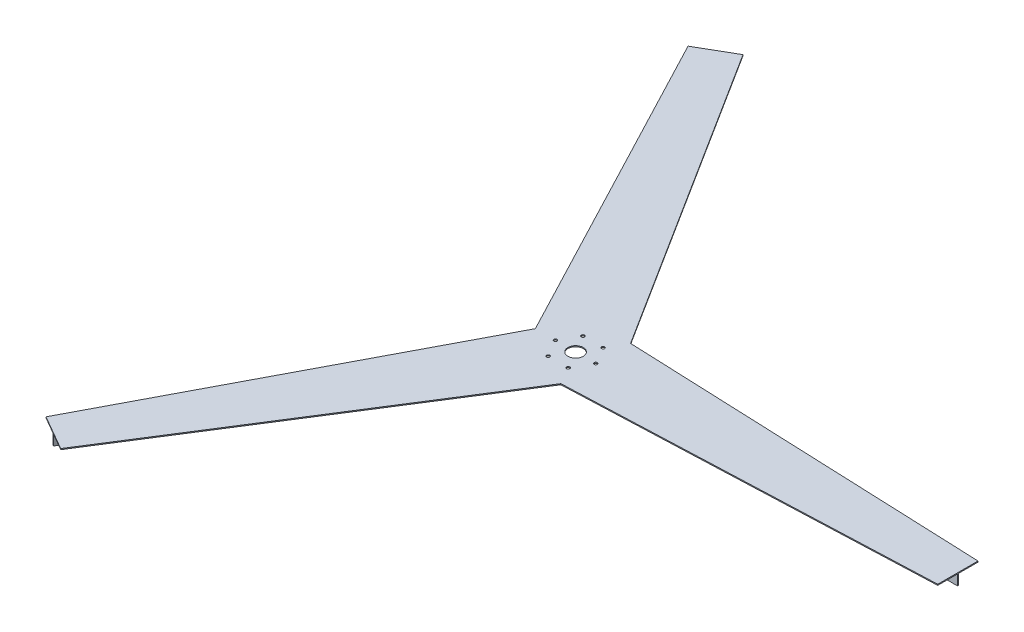
from build123d import *

# Parameters (mm, degrees)
CROQUIS1_R              = 19.05
SALIENTE_EXTRUIR3_DEPTH = 2.5
CROQUIS2_W              = 885
CROQUIS2_H              = 2.5
SALIENTE_EXTRUIR4_DEPTH = 25.4
CROQUIS4_R              = 4
CORTAR_EXTRUIR1_DEPTH   = 2.54


with BuildPart() as part:
    # Croquis1 → Saliente-Extruir3 (new body)
    with BuildSketch(Plane(origin=(0, 0, 0), x_dir=(1, 0, 0), z_dir=(0, 1, 0))):
        Polygon((-518.301270189, -797.724133595), (-431.698729811, -847.724133595), (50, -86.602540378), (950, -50), (950, 50), (50, 86.602540378), (-431.698729811, 847.724133595), (-518.301270189, 797.724133595), (-100, 0), align=None)
        Circle(CROQUIS1_R, mode=Mode.SUBTRACT)
    extrude(amount=SALIENTE_EXTRUIR3_DEPTH)

    # Croquis2 → Saliente-Extruir4 (add)
    with BuildSketch(Plane.XZ):
        with Locations((507.5, 0)):
            Rectangle(CROQUIS2_W, CROQUIS2_H)
        Polygon((-473.917468245, -823.349133595), (-31.417468245, -56.916651246), (-33.582531755, -55.666651246), (-476.082531755, -822.099133595), align=None)
        Polygon((-476.082531755, 822.099133595), (-33.582531755, 55.666651246), (-31.417468245, 56.916651246), (-473.917468245, 823.349133595), align=None)
    extrude(amount=SALIENTE_EXTRUIR4_DEPTH)

    # Croquis4 → Cortar-Extruir1 (cut)
    with BuildSketch(Plane(origin=(0, 2.5, 0), x_dir=(1, 0, 0), z_dir=(0, 1, 0))):
        with Locations((25, -43.301270189)):
            Circle(CROQUIS4_R)
        with Locations((-25, -43.301270189)):
            Circle(CROQUIS4_R)
        with Locations((-50, 0)):
            Circle(CROQUIS4_R)
        with Locations((-25, 43.301270189)):
            Circle(CROQUIS4_R)
        with Locations((25, 43.301270189)):
            Circle(CROQUIS4_R)
        with Locations((50, 0)):
            Circle(CROQUIS4_R)
    extrude(amount=-CORTAR_EXTRUIR1_DEPTH, mode=Mode.SUBTRACT)


solid = part.part
